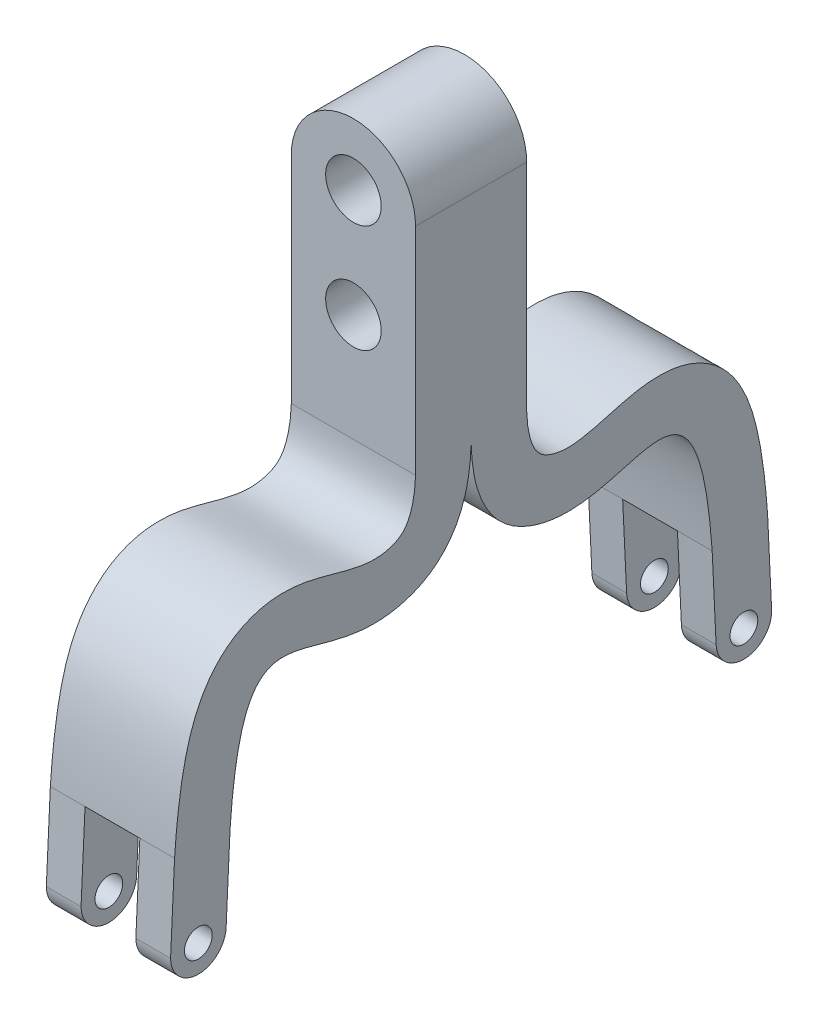
from build123d import *

# Parameters (mm, degrees)
RESSALTO_EXTRUS_O1_DEPTH = 16
ESBO_O2_R                = 4
CORTE_EXTRUS_O1_DEPTH    = 16
VARREDURA4_START         = -8.652301107
VARREDURA4_DEPTH         = 17.88854382
ESBO_O15_W               = 5
ESBO_O15_H               = 8
RESSALTO_EXTRUS_O2_DEPTH = 16
CORTE_EXTRUS_O2_START    = -17.88854382
CORTE_EXTRUS_O2_DEPTH    = 17.88854382
CORTE_EXTRUS_O3_REACH    = 87.789
ESBO_O17_R               = 2


# Read off the part's stored shape, not the designer's step: Varredura4, Corte-extrusão2
with BuildPart() as part:
    # Esboço1 → Ressalto-extrusão1 (new body)
    with BuildSketch(Plane.XY):
        with BuildLine():
            Line((-8.652301107, 11.230910572), (-8.652301107, -19.824817518))
            Line((-8.652301107, -19.824817518), (9.236242713, -19.824817518))
            Line((9.236242713, -19.824817518), (9.236242713, 11.230910572))
            ThreePointArc((9.236242713, 11.230910572), (0.291970803, 20.175182482), (-8.652301107, 11.230910572))
        make_face()
    extrude(amount=RESSALTO_EXTRUS_O1_DEPTH)

    # Esboço2 → Corte-extrusão1 (cut)
    with BuildSketch(Plane.XY.offset(16)):
        with Locations((0.291970803, -4.296953473)):
            Circle(ESBO_O2_R)
        with Locations((0.291970803, 11.230910572)):
            Circle(ESBO_O2_R)
    extrude(amount=-CORTE_EXTRUS_O1_DEPTH, mode=Mode.SUBTRACT)

    # Varredura4 outline → Varredura4 (add)
    with BuildSketch(Plane.YZ.offset(VARREDURA4_START)):
        with BuildLine():
            add(Edge.make_bspline(
                [(-19.824817518, 8), (-22.439544913, 8.061571054), (-24.623287523, 8.441664556), (-28.267178069, 9.661368947), (-29.727325999, 10.50097984), (-32.062402069, 12.462191499), (-32.937330202, 13.583792272), (-34.240341563, 15.931456179), (-34.668424783, 17.157519322), (-35.330505777, 20.033439467), (-35.408748628, 21.646403898), (-35.20256302, 24.717616963), (-34.918134548, 26.175865598), (-34.243914827, 28.929781571), (-33.854123563, 30.22544891), (-33.226486793, 32.64633679), (-32.988641268, 33.771557331), (-32.938813703, 35.325653919), (-32.973361291, 35.821397078), (-33.176933617, 36.767322133), (-33.34595834, 37.217504029), (-33.850648501, 38.071323372), (-34.186313926, 38.474960818), (-35.056449054, 39.234708074), (-35.590918748, 39.590817882), (-37.540779591, 40.586381071), (-39.302622482, 41.153068212), (-44.007488139, 42.084533694), (-46.950510899, 42.449312033), (-50.61277786, 42.70920322)],
                knots=[0, 0, 0, 0, 0.065182476, 0.065182476, 0.130364951, 0.130364951, 0.195547427, 0.195547427, 0.260729903, 0.260729903, 0.353138665, 0.353138665, 0.445547427, 0.445547427, 0.537956189, 0.537956189, 0.630364951, 0.630364951, 0.676569332, 0.676569332, 0.722773714, 0.722773714, 0.768978095, 0.768978095, 0.815182476, 0.815182476, 0.907591238, 0.907591238, 1, 1, 1, 1], degree=3))
            Line((-19.824817518, 8), (-19.824817518, 16))
            add(Edge.make_bspline(
                [(-19.824817518, 16), (-21.774686132, 16.06173473), (-23.145738974, 16.358094635), (-25.024660187, 17.032874402), (-25.536545073, 17.393767435), (-26.25416329, 18.060184701), (-26.47923597, 18.386053866), (-26.895433292, 19.220988075), (-27.07026944, 19.736971968), (-27.361216682, 21.158300267), (-27.388273549, 21.942906287), (-27.238167367, 23.725479822), (-27.047998042, 24.715967726), (-26.487759721, 26.951800675), (-26.115769752, 28.184037655), (-25.386653844, 31.038077204), (-24.997757996, 32.665959741), (-24.934689618, 35.776361991), (-25.012790973, 36.932164941), (-25.579214205, 39.390134415), (-26.081439863, 40.686584232), (-27.536957424, 43.065825465), (-28.47694892, 44.131329827), (-30.529106476, 45.875079195), (-31.633675167, 46.564599127), (-35.047794697, 48.264833596), (-37.465791868, 48.95383716), (-43.107313789, 50.047926754), (-46.34362004, 50.429476501), (-50.23450008, 50.700254836)],
                knots=[0, 0, 0, 0, 0.065182476, 0.065182476, 0.130364951, 0.130364951, 0.195547427, 0.195547427, 0.260729903, 0.260729903, 0.353138665, 0.353138665, 0.445547427, 0.445547427, 0.537956189, 0.537956189, 0.630364951, 0.630364951, 0.676569332, 0.676569332, 0.722773714, 0.722773714, 0.768978095, 0.768978095, 0.815182476, 0.815182476, 0.907591238, 0.907591238, 1, 1, 1, 1], degree=3))
            Line((-50.23450008, 50.700254836), (-50.61277786, 42.70920322))
        make_face()
    varredura4 = extrude(amount=VARREDURA4_DEPTH)

    # Esboço15 → Ressalto-extrusão2 (add)
    with BuildSketch(Plane(origin=(0, -52.516849458, 2.486025393), x_dir=(1, 0, 0), z_dir=(0, -0.9988814519329183, 0.047284722526256866))):
        with Locations((6.736242713, 44.268219766)):
            Rectangle(ESBO_O15_W, ESBO_O15_H)
        with Locations((-6.152301107, 44.268219766)):
            Rectangle(ESBO_O15_W, ESBO_O15_H)
    ressalto_extrus_o2 = extrude(amount=RESSALTO_EXTRUS_O2_DEPTH)

    # Corte-extrusão2 outline → Corte-extrusão2 (cut)
    with BuildSketch(Plane(origin=(9.236242713, 0, 0), x_dir=(0, 0, -1), z_dir=(1, 0, 0)).offset(CORTE_EXTRUS_O2_START)):
        with BuildLine():
            ThreePointArc((-43.276619891, -62.599355283), (-44.580640022, -65.369236027), (-47.461328674, -66.405740114))
            Line((-47.461328674, -66.405740114), (-43.465758781, -66.594881091))
            Line((-43.465758781, -66.594881091), (-43.276619891, -62.599355283))
        make_face()
        with BuildLine():
            ThreePointArc((-47.461328674, -66.405740114), (-50.166686414, -65.170947102), (-51.272145698, -62.410216393))
            Line((-51.272145698, -62.410216393), (-51.277431853, -62.427263119))
            Line((-51.277431853, -62.427263119), (-51.456810396, -66.216603311))
            Line((-51.456810396, -66.216603311), (-47.461328674, -66.405740114))
        make_face()
    corte_extrus_o2 = extrude(amount=CORTE_EXTRUS_O2_DEPTH, mode=Mode.SUBTRACT)

    # Corte-extrusão3: up to this face of the body (flat: up to its plane)
    corte_extrus_o3_end = Plane(part.part.faces().sort_by_distance((-8.652301107, -4.296953473, 0.930457934))[0])
    # Esboço17 → Corte-extrusão3 (cut, up to the picked face)
    with BuildSketch(Plane(origin=(9.236242713, 0, 0), x_dir=(0, 0, -1), z_dir=(1, 0, 0)), mode=Mode.PRIVATE) as corte_extrus_o3_sk1:
        with Locations(Location((-47.277025872, -62.513309201, 0), (0, 0, 90))):
            Circle(ESBO_O17_R)
    corte_extrus_o3_tool1 = split(extrude(corte_extrus_o3_sk1.sketch, amount=-CORTE_EXTRUS_O3_REACH, mode=Mode.PRIVATE), bisect_by=corte_extrus_o3_end, keep=Keep.BOTH, mode=Mode.PRIVATE)
    corte_extrus_o3 = corte_extrus_o3_tool1.solids().sort_by(Axis((9.236243, -62.513309, 47.277026), (-1, 0, 0)))[0]
    add(corte_extrus_o3, mode=Mode.SUBTRACT)

    # Espelhar4: Varredura4, Ressalto-extrusão2, Corte-extrusão2, Corte-extrusão3 across plane
    add(varredura4.mirror(Plane.XY.offset(8)))
    add(ressalto_extrus_o2.mirror(Plane.XY.offset(8)))
    add(corte_extrus_o2.mirror(Plane.XY.offset(8)), mode=Mode.SUBTRACT)
    add(corte_extrus_o3.mirror(Plane.XY.offset(8)), mode=Mode.SUBTRACT)


solid = part.part
